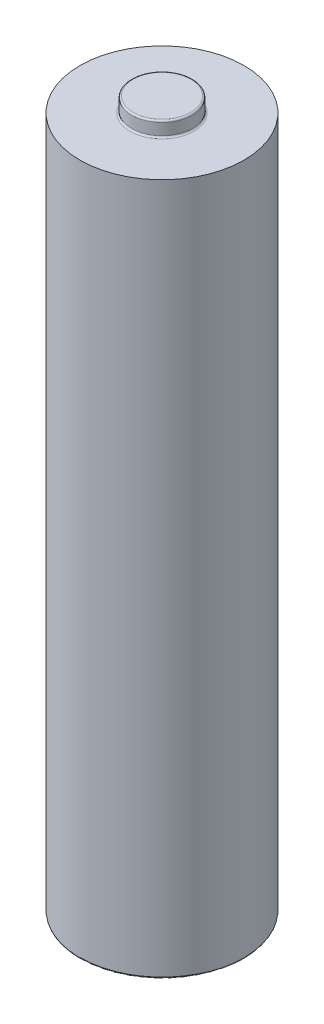
from build123d import *

# Parameters (mm, degrees)
FILLET1_R = 0.1


with BuildPart() as part:
    # Sketch1 → Revolve1 (revolve)
    with BuildSketch(Plane.XY):
        Polygon((0, 0), (-2.7, 0), (-2.7, 0.9), (-5, 0.9), (-5, 43.1), (-1.85, 43.1), (-1.85, 44), (0, 44), align=None)
    revolve(axis=Axis((0, 44, 0), (0, -1, 0)))

    # Fillet1
    fillet1_edges = [part.edges().sort_by_distance(p)[0] for p in [
        (1.85, 43.1, 0),
        (2.7, 0, 0),
        (5, 0.9, 0),
        (2.7, 0.9, 0),
        (1.85, 44, 0),
    ]]
    fillet(fillet1_edges, radius=FILLET1_R)


solid = part.part
